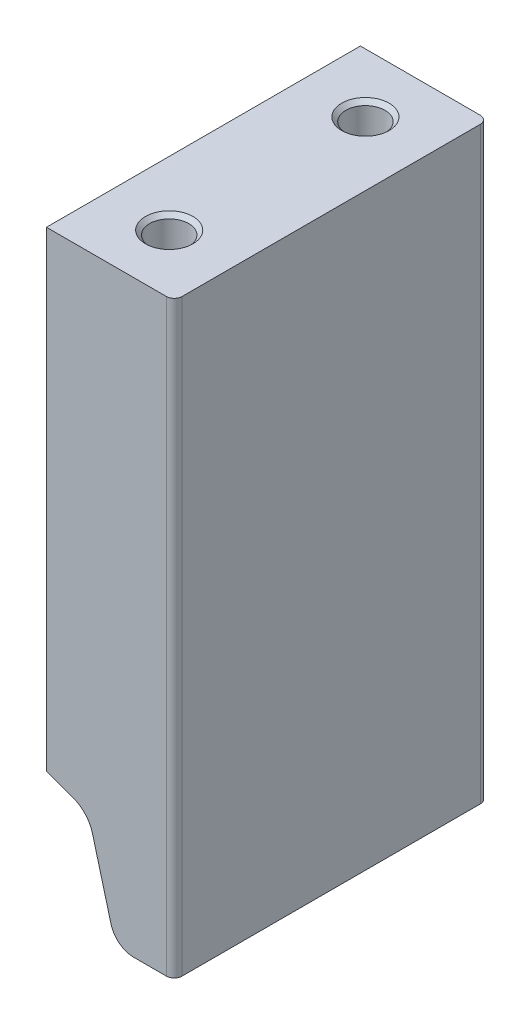
from build123d import *

# Parameters (mm, degrees)
SKETCH1_W                   = 16.28
SKETCH1_H                   = 40
BOSS_EXTRUDE1_DEPTH         = 75
CUT_EXTRUDE1_REACH          = 87.389
FILLET1_R                   = 3
FILLET2_R                   = 1
M6_TAPPED_HOLE1_D           = 5
M6_TAPPED_HOLE1_DEPTH       = 17
M6_TAPPED_HOLE1_CSINK_D     = 6.05
M6_TAPPED_HOLE1_CSINK_ANGLE = 90
M6_TAPPED_HOLE1_TIP         = 1.502151548


with BuildPart() as part:
    # Sketch1 → Boss-Extrude1 (new body)
    with BuildSketch(Plane(origin=(0, 0, 0), x_dir=(1, 0, 0), z_dir=(0, 1, 0))):
        Rectangle(SKETCH1_W, SKETCH1_H)
    extrude(amount=-BOSS_EXTRUDE1_DEPTH)

    # Sketch2 → Cut-Extrude1 (cut, up to next)
    with BuildSketch(Plane.XY.offset(20), mode=Mode.PRIVATE) as cut_extrude1_sk1:
        with BuildLine():
            Line((-4.771919427, -61.241229517), (-8.14, -60.015348442))
            Line((-8.14, -60.015348442), (-8.14, -75))
            Line((-8.14, -75), (0.680596646, -75))
            Line((0.680596646, -75), (-2.276296695, -63.96472382))
            ThreePointArc((-2.276296695, -63.96472382), (-3.190890653, -62.29763917), (-4.771919427, -61.241229517))
        make_face()
    cut_extrude1_tool1 = extrude(cut_extrude1_sk1.sketch, amount=-CUT_EXTRUDE1_REACH, mode=Mode.PRIVATE) & part.part
    add(cut_extrude1_tool1.solids().sort_by_distance((-4.638946, -68.648794, 20))[0], mode=Mode.SUBTRACT)

    # Fillet1
    fillet1_edges = [part.edges().sort_by_distance(p)[0] for p in [
        (0.680596646, -75, 0),
    ]]
    fillet(fillet1_edges, radius=FILLET1_R)

    # Fillet2
    fillet2_edges = [part.edges().sort_by_distance(p)[0] for p in [
        (8.14, -37.5, -20),
        (8.14, -37.5, 20),
    ]]
    fillet(fillet2_edges, radius=FILLET2_R)

    # M6 Tapped Hole1
    with Locations(Plane(origin=(0, 0, 0), x_dir=(1, 0, 0), z_dir=(0, 1, 0))):
        with Locations((0, 12.5), (0, -12.5)):
            CounterSinkHole(M6_TAPPED_HOLE1_D / 2, M6_TAPPED_HOLE1_CSINK_D / 2, depth=M6_TAPPED_HOLE1_DEPTH, counter_sink_angle=M6_TAPPED_HOLE1_CSINK_ANGLE)
            with Locations((0, 0, -(M6_TAPPED_HOLE1_DEPTH + M6_TAPPED_HOLE1_TIP / 2))):  # 118° drill point
                Cone(0, M6_TAPPED_HOLE1_D / 2, M6_TAPPED_HOLE1_TIP, mode=Mode.SUBTRACT)


solid = part.part
